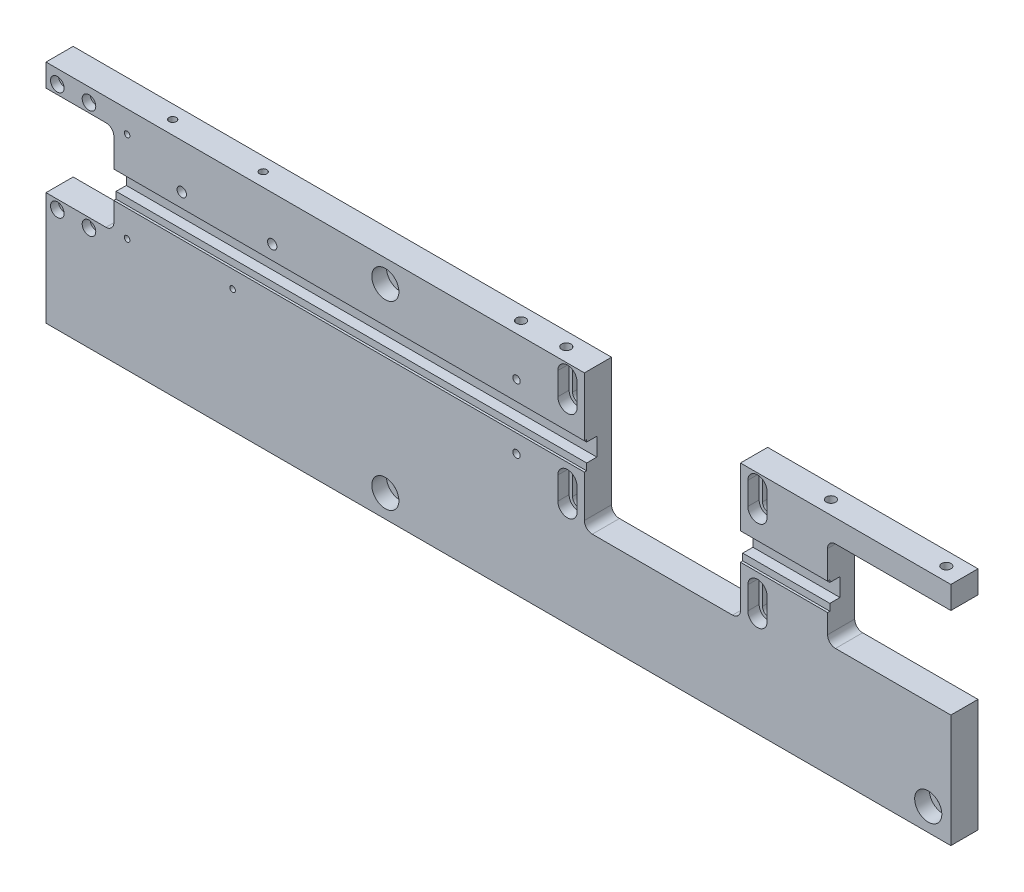
from build123d import *

# Parameters (mm, degrees)
SKETCH1_W                    = 400
SKETCH1_H                    = 100
BASE_DEPTH                   = 12
PART_TAPE_MOVER_CUTOUT_DEPTH = 207.504237245
PRESS_PLATE_CUTOUT_DEPTH     = 207.504237245
ROLLER_CUTOUT_DEPTH          = 207.504237245
SKETCH5_W                    = 315.5
SKETCH5_H                    = 8
PART_TAPE_CUTOUT_DEPTH       = 5.5
SKETCH6_W                    = 315.5
SKETCH6_H                    = 12
CUT_EXTRUDE5_DEPTH           = 1
SKETCH7_R                    = 6
CUT_EXTRUDE6_DEPTH           = 6.5
SKETCH8_R                    = 3.25
CUT_EXTRUDE7_DEPTH           = 207.257727128
SKETCH9_R                    = 2.065
CUT_EXTRUDE8_DEPTH           = 10
CUT_EXTRUDE9_DEPTH           = 5
CUT_EXTRUDE10_DEPTH          = 207.274089502
LPATTERN1_COUNT              = 2
LPATTERN1_PITCH              = 84
LPATTERN1_COUNT_DIR2         = 2
LPATTERN1_PITCH_DIR2         = 40
SKETCH13_R                   = 3
CUT_EXTRUDE11_DEPTH          = 3.5
SKETCH14_R                   = 1.5
CUT_EXTRUDE12_DEPTH          = 207.33043886
LPATTERN2_COUNT              = 2
LPATTERN2_PITCH              = 48
SKETCH15_R                   = 1.23
CUT_EXTRUDE13_DEPTH          = 207.504237245
SKETCH16_R                   = 2.065
CUT_EXTRUDE14_DEPTH          = 207.504237245
SKETCH18_R                   = 1.62
CUT_EXTRUDE15_DEPTH          = 207.504237245
SKETCH19_R                   = 2.065
SKETCH19_R_2                 = 1.62
CUT_EXTRUDE16_DEPTH          = 8


with BuildPart() as part:
    # Sketch1 → Base (new body)
    with BuildSketch(Plane.XY):
        Rectangle(SKETCH1_W, SKETCH1_H)
    extrude(amount=BASE_DEPTH)

    # Sketch2 → Part Tape Mover Cutout (cut, through all)
    with BuildSketch(Plane.XY.offset(12)):
        with BuildLine():
            Line((200, 0), (149, 0))
            ThreePointArc((149, 0), (146.525126266, 1.025126266), (145.5, 3.5))
            Line((145.5, 3.5), (145.5, 36.5))
            ThreePointArc((145.5, 36.5), (146.525126266, 38.974873734), (149, 40))
            Line((149, 40), (200, 40))
            Line((200, 40), (200, 0))
        make_face()
    extrude(amount=-PART_TAPE_MOVER_CUTOUT_DEPTH, mode=Mode.SUBTRACT)

    # Sketch3 → Press Plate Cutout (cut, through all)
    with BuildSketch(Plane.XY.offset(12)):
        with BuildLine():
            Line((41.5, -10), (103.5, -10))
            ThreePointArc((103.5, -10), (105.974873734, -8.974873734), (107, -6.5))
            Line((107, -6.5), (107, 50))
            Line((107, 50), (38, 50))
            Line((38, 50), (38, -6.5))
            ThreePointArc((38, -6.5), (39.025126266, -8.974873734), (41.5, -10))
        make_face()
    extrude(amount=-PRESS_PLATE_CUTOUT_DEPTH, mode=Mode.SUBTRACT)

    # Sketch4 → Roller Cutout (cut, through all)
    with BuildSketch(Plane.XY.offset(12)):
        with BuildLine():
            Line((-200, 40), (-173.5, 40))
            ThreePointArc((-173.5, 40), (-171.025126266, 38.974873734), (-170, 36.5))
            Line((-170, 36.5), (-170, 3.5))
            ThreePointArc((-170, 3.5), (-171.025126266, 1.025126266), (-173.5, 0))
            Line((-173.5, 0), (-200, 0))
            Line((-200, 0), (-200, 40))
        make_face()
    extrude(amount=-ROLLER_CUTOUT_DEPTH, mode=Mode.SUBTRACT)

    # Sketch5 → Part Tape Cutout (cut)
    with BuildSketch(Plane.XY.offset(12)):
        with Locations((-12.25, 19)):
            Rectangle(SKETCH5_W, SKETCH5_H)
    extrude(amount=-PART_TAPE_CUTOUT_DEPTH, mode=Mode.SUBTRACT)

    # Sketch6 → Cut-Extrude5 (cut)
    with BuildSketch(Plane.XY.offset(12)):
        with Locations((-12.25, 18)):
            Rectangle(SKETCH6_W, SKETCH6_H)
    extrude(amount=-CUT_EXTRUDE5_DEPTH, mode=Mode.SUBTRACT)

    # Sketch7 → Cut-Extrude6 (cut)
    with BuildSketch(Plane.XY.offset(12)):
        with Locations((190, -40)):
            Circle(SKETCH7_R)
        with Locations((-50, -40)):
            Circle(SKETCH7_R)
        with Locations((-50, 40)):
            Circle(SKETCH7_R)
    extrude(amount=-CUT_EXTRUDE6_DEPTH, mode=Mode.SUBTRACT)

    # Sketch8 → Cut-Extrude7 (cut, through all)
    with BuildSketch(Plane.XY.offset(5.5)):
        with Locations((190, -40)):
            Circle(SKETCH8_R)
        with Locations((-50, -40)):
            Circle(SKETCH8_R)
        with Locations((-50, 40)):
            Circle(SKETCH8_R)
    extrude(amount=-CUT_EXTRUDE7_DEPTH, mode=Mode.SUBTRACT)

    # Sketch9 → Cut-Extrude8 (cut)
    with BuildSketch(Plane(origin=(0, 50, 0), x_dir=(1, 0, 0), z_dir=(0, 1, 0))):
        with Locations((141, -6)):
            Circle(SKETCH9_R)
        with Locations((192, -6)):
            Circle(SKETCH9_R)
    extrude(amount=-CUT_EXTRUDE8_DEPTH, mode=Mode.SUBTRACT)

    # Sketch11 → Cut-Extrude9 (cut)
    with BuildSketch(Plane.XY.offset(12)):
        with BuildLine():
            Line((110.25, 35), (110.25, 45))
            ThreePointArc((110.25, 45), (114.5, 49.25), (118.75, 45))
            Line((118.75, 45), (118.75, 35))
            ThreePointArc((118.75, 35), (114.5, 30.75), (110.25, 35))
        make_face()
    cut_extrude9 = extrude(amount=-CUT_EXTRUDE9_DEPTH, mode=Mode.SUBTRACT)

    # Sketch12 → Cut-Extrude10 (cut, through all)
    with BuildSketch(Plane.XY.offset(7)):
        with BuildLine():
            Line((117.25, 35), (117.25, 45))
            ThreePointArc((117.25, 45), (114.5, 47.75), (111.75, 45))
            Line((111.75, 45), (111.75, 35))
            ThreePointArc((111.75, 35), (114.5, 32.25), (117.25, 35))
        make_face()
    cut_extrude10 = extrude(amount=-CUT_EXTRUDE10_DEPTH, mode=Mode.SUBTRACT)

    # LPattern1: Cut-Extrude9, Cut-Extrude10 2 × 2
    with Locations(*[(-i * LPATTERN1_PITCH, -j * LPATTERN1_PITCH_DIR2, 0) for i in range(LPATTERN1_COUNT) for j in range(LPATTERN1_COUNT_DIR2) if (i, j) != (0, 0)]):
        add(cut_extrude9, mode=Mode.SUBTRACT)
        add(cut_extrude10, mode=Mode.SUBTRACT)

    # Sketch13 → Cut-Extrude11 (cut)
    with BuildSketch(Plane.XY.offset(12)):
        with Locations((-181, 44)):
            Circle(SKETCH13_R)
        with Locations((-195, 44)):
            Circle(SKETCH13_R)
    cut_extrude11 = extrude(amount=-CUT_EXTRUDE11_DEPTH, mode=Mode.SUBTRACT)

    # Sketch14 → Cut-Extrude12 (cut, through all)
    with BuildSketch(Plane.XY.offset(8.5)):
        with Locations((-181, 44)):
            Circle(SKETCH14_R)
        with Locations((-195, 44)):
            Circle(SKETCH14_R)
    cut_extrude12 = extrude(amount=-CUT_EXTRUDE12_DEPTH, mode=Mode.SUBTRACT)

    # LPattern2: Cut-Extrude11, Cut-Extrude12 ×2
    with Locations(*[(0, -i * LPATTERN2_PITCH, 0) for i in range(1, LPATTERN2_COUNT)]):
        add(cut_extrude11, mode=Mode.SUBTRACT)
        add(cut_extrude12, mode=Mode.SUBTRACT)

    # Sketch15 → Cut-Extrude13 (cut, through all)
    with BuildSketch(Plane.XY.offset(12)):
        with Locations((-164.15, 40.25)):
            Circle(SKETCH15_R)
        with Locations((-164.15, 0.25)):
            Circle(SKETCH15_R)
        with Locations((-117.5, 4.3)):
            Circle(SKETCH15_R)
    extrude(amount=-CUT_EXTRUDE13_DEPTH, mode=Mode.SUBTRACT)

    # Sketch16 → Cut-Extrude14 (cut, through all)
    with BuildSketch(Plane.XY.offset(12)):
        with Locations((-140, 30.25)):
            Circle(SKETCH16_R)
        with Locations((-100, 30.25)):
            Circle(SKETCH16_R)
    extrude(amount=-CUT_EXTRUDE14_DEPTH, mode=Mode.SUBTRACT)

    # Sketch18 → Cut-Extrude15 (cut, through all)
    with BuildSketch(Plane.XY.offset(12)):
        with Locations((8, 32.5)):
            Circle(SKETCH18_R)
        with Locations((8, 4)):
            Circle(SKETCH18_R)
    extrude(amount=-CUT_EXTRUDE15_DEPTH, mode=Mode.SUBTRACT)

    # Sketch19 → Cut-Extrude16 (cut)
    with BuildSketch(Plane(origin=(0, 50, 0), x_dir=(1, 0, 0), z_dir=(0, 1, 0))):
        with Locations((24, -6)):
            Circle(SKETCH19_R)
        with Locations((4, -6)):
            Circle(SKETCH19_R)
        with Locations((-110, -6)):
            Circle(SKETCH19_R_2)
        with Locations((-150, -6)):
            Circle(SKETCH19_R_2)
    extrude(amount=-CUT_EXTRUDE16_DEPTH, mode=Mode.SUBTRACT)


solid = part.part
